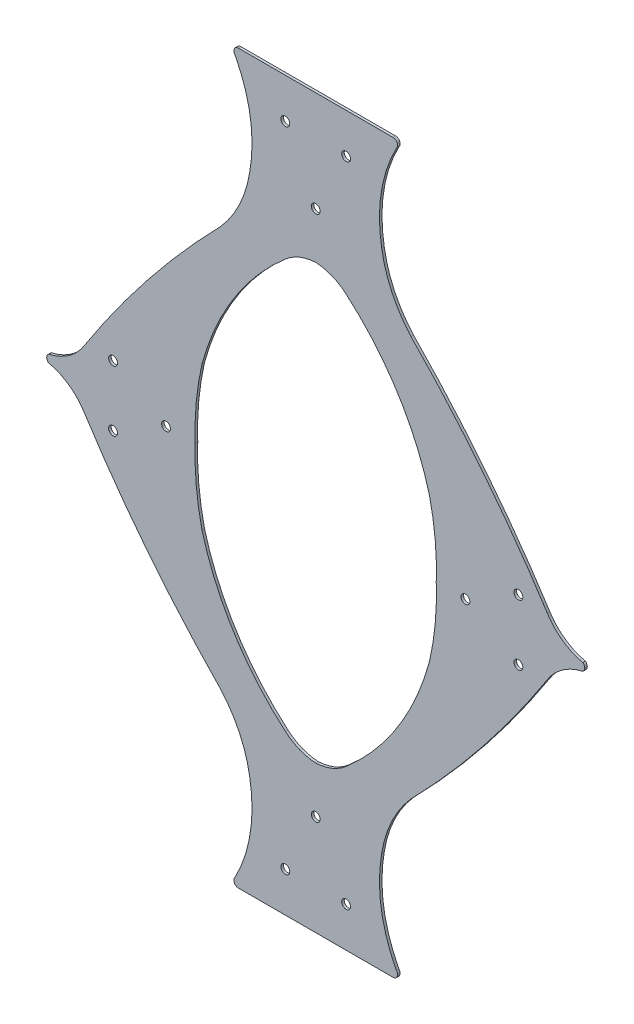
from build123d import *

# Parameters (mm, degrees)
MODEL_R             = 11.1125
BOSS_EXTRUDE1_DEPTH = 6.35


with BuildPart() as part:
    # Model → Boss-Extrude1 (new body)
    with BuildSketch(Plane.XY):
        with BuildLine():
            Line((194.479849892, 914.4), (0, 914.4))
            Line((0, 914.4), (-194.479849892, 914.4))
            ThreePointArc((-194.479849892, 914.4), (-204.91887294, 907.625287079), (-202.983200568, 895.332073104))
            ThreePointArc((-202.983200568, 895.332073104), (-164.53997599, 779.84204369), (-165.938886188, 658.129795087))
            ThreePointArc((-165.938886188, 658.129795087), (-191.627212465, 575.297388544), (-239.683438479, 503.105305724))
            ThreePointArc((-239.683438479, 503.105305724), (-421.799875664, 296.628923535), (-582.037423099, 72.747657041))
            ThreePointArc((-582.037423099, 72.747657041), (-620.339092239, 32.211350911), (-671.307126152, 9.573561873))
            ThreePointArc((-671.307126152, 9.573561873), (-674.990888604, 5.409489793), (-676.274252252, 0))
            ThreePointArc((-676.274252252, 0), (-674.990888604, -5.409489793), (-671.307126152, -9.573561873))
            ThreePointArc((-671.307126152, -9.573561873), (-620.339092239, -32.211350911), (-582.037423099, -72.747657041))
            ThreePointArc((-582.037423099, -72.747657041), (-421.799875664, -296.628923535), (-239.683438479, -503.105305724))
            ThreePointArc((-239.683438479, -503.105305724), (-191.627212465, -575.297388544), (-165.938886188, -658.129795087))
            ThreePointArc((-165.938886188, -658.129795087), (-164.53997599, -779.84204369), (-202.983200568, -895.332073104))
            ThreePointArc((-202.983200568, -895.332073104), (-204.91887294, -907.625287079), (-194.479849892, -914.4))
            Line((-194.479849892, -914.4), (0, -914.4))
            Line((0, -914.4), (194.479849892, -914.4))
            ThreePointArc((194.479849892, -914.4), (204.91887294, -907.625287079), (202.983200568, -895.332073104))
            ThreePointArc((202.983200568, -895.332073104), (164.53997599, -779.84204369), (165.938886188, -658.129795087))
            ThreePointArc((165.938886188, -658.129795087), (191.627212465, -575.297388544), (239.683438479, -503.105305724))
            ThreePointArc((239.683438479, -503.105305724), (421.799875662, -296.628923537), (582.037423096, -72.747657046))
            ThreePointArc((582.037423096, -72.747657046), (620.339092236, -32.211350913), (671.307126153, -9.573561873))
            ThreePointArc((671.307126153, -9.573561873), (674.990888604, -5.409489793), (676.274252252, 0))
            ThreePointArc((676.274252252, 0), (674.990888604, 5.409489793), (671.307126153, 9.573561873))
            ThreePointArc((671.307126153, 9.573561873), (620.339092238, 32.211350911), (582.037423098, 72.747657043))
            ThreePointArc((582.037423098, 72.747657043), (421.799875663, 296.628923535), (239.68343848, 503.105305724))
            ThreePointArc((239.68343848, 503.105305724), (191.627212465, 575.297388544), (165.938886188, 658.129795087))
            ThreePointArc((165.938886188, 658.129795087), (164.53997599, 779.84204369), (202.983200568, 895.332073104))
            ThreePointArc((202.983200568, 895.332073104), (204.91887294, 907.625287079), (194.479849892, 914.4))
        make_face()
        with Locations((-76.391165429, -814.137155179)):
            Circle(MODEL_R, mode=Mode.SUBTRACT)
        with Locations((0, -661.9875)):
            Circle(MODEL_R, mode=Mode.SUBTRACT)
        with Locations((-509.493300006, -76.235020602)):
            Circle(MODEL_R, mode=Mode.SUBTRACT)
        with BuildLine():
            ThreePointArc((-285.980677562, 180.680860188), (-206.164385374, 363.28615193), (-76.1317559, 514.305516062))
            ThreePointArc((-76.1317559, 514.305516062), (-40.620898237, 536.014461284), (0, 545.083195538))
            ThreePointArc((0, 545.083195538), (40.620898237, 536.014461284), (76.1317559, 514.305516062))
            ThreePointArc((76.1317559, 514.305516062), (206.164385374, 363.28615193), (285.980677561, 180.680860188))
            ThreePointArc((285.980677561, 180.680860188), (300.404511438, 90.898144517), (302.956048262, 0))
            ThreePointArc((302.956048262, 0), (300.404511438, -90.898144517), (285.980677561, -180.680860188))
            ThreePointArc((285.980677561, -180.680860188), (206.164385374, -363.28615193), (76.1317559, -514.305516062))
            ThreePointArc((76.1317559, -514.305516062), (40.620898237, -536.014461284), (0, -545.083195538))
            ThreePointArc((0, -545.083195538), (-40.620898237, -536.014461284), (-76.1317559, -514.305516062))
            ThreePointArc((-76.1317559, -514.305516062), (-206.164385375, -363.28615193), (-285.980677562, -180.680860187))
            ThreePointArc((-285.980677562, -180.680860187), (-300.404511439, -90.898144517), (-302.956048262, 0))
            ThreePointArc((-302.956048262, 0), (-300.404511438, 90.898144517), (-285.980677562, 180.680860188))
        make_face(mode=Mode.SUBTRACT)
        with Locations((76.391165429, -814.137155179)):
            Circle(MODEL_R, mode=Mode.SUBTRACT)
        with Locations((509.493300006, -76.235020602)):
            Circle(MODEL_R, mode=Mode.SUBTRACT)
        with Locations((-509.493300006, 76.235020602)):
            Circle(MODEL_R, mode=Mode.SUBTRACT)
        with Locations((-376.393644827, 0)):
            Circle(MODEL_R, mode=Mode.SUBTRACT)
        with Locations((0, 661.9875)):
            Circle(MODEL_R, mode=Mode.SUBTRACT)
        with Locations((-76.391165429, 814.137155179)):
            Circle(MODEL_R, mode=Mode.SUBTRACT)
        with Locations((376.393644827, 0)):
            Circle(MODEL_R, mode=Mode.SUBTRACT)
        with Locations((509.493300006, 76.235020602)):
            Circle(MODEL_R, mode=Mode.SUBTRACT)
        with Locations((76.391165429, 814.137155179)):
            Circle(MODEL_R, mode=Mode.SUBTRACT)
    extrude(amount=BOSS_EXTRUDE1_DEPTH)


solid = part.part
